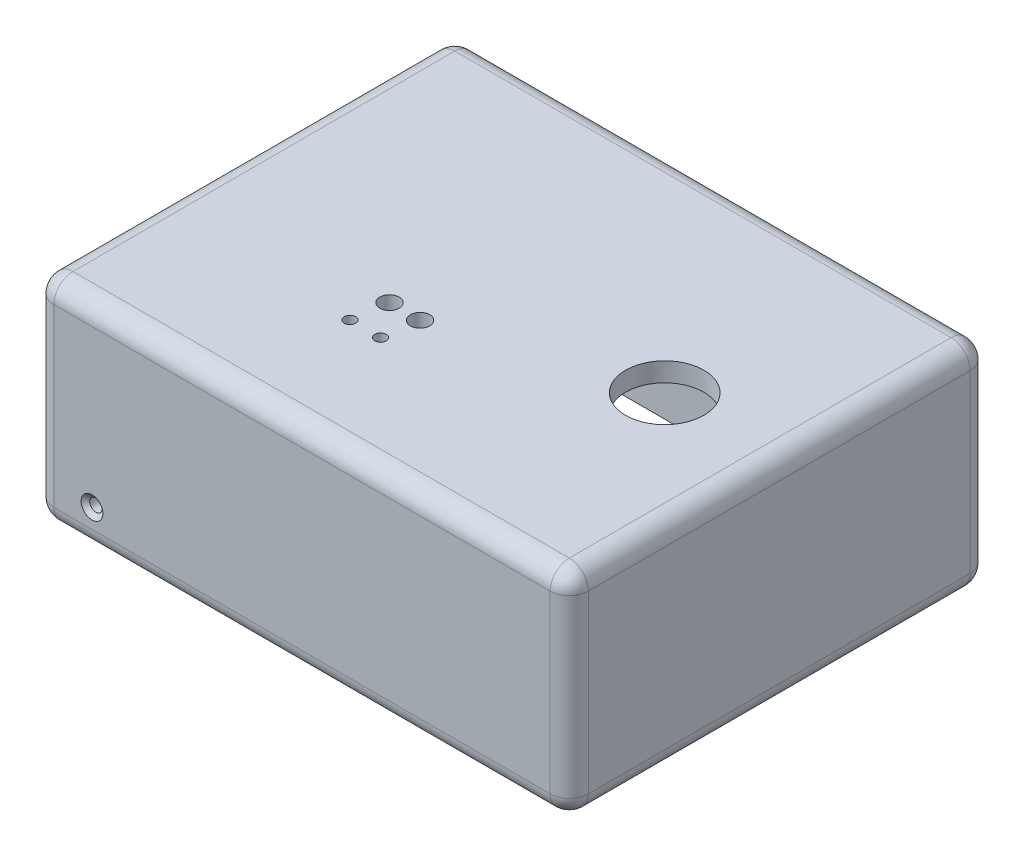
from build123d import *

# Parameters (mm, degrees)
SKETCH1_W                                         = 140
SKETCH1_H                                         = 110
BOSS_EXTRUDE1_DEPTH                               = 56
SKETCH2_W                                         = 130
SKETCH2_H                                         = 100
CUT_EXTRUDE1_DEPTH                                = 51
FILLET1_R                                         = 5
FILLET2_R                                         = 5
FILLET3_R                                         = 5
FILLET4_R                                         = 5
FILLET6_R                                         = 5
SKETCH3_R                                         = 2.54
CUT_EXTRUDE2_DEPTH                                = 5
SKETCH4_R                                         = 10.25
CUT_EXTRUDE3_DEPTH                                = 5
SKETCH5_R                                         = 1.5
CUT_EXTRUDE4_DEPTH                                = 5
CSK_FOR_4_FLAT_HEAD_MACHINE_SCREW_100_D           = 3.2639
CSK_FOR_4_FLAT_HEAD_MACHINE_SCREW_100_DEPTH       = 10
CSK_FOR_4_FLAT_HEAD_MACHINE_SCREW_100_CSINK_D     = 5.715
CSK_FOR_4_FLAT_HEAD_MACHINE_SCREW_100_CSINK_ANGLE = 100
CSK_FOR_4_FLAT_HEAD_MACHINE_SCREW_100_TIP         = 0.980574487
CSK_FOR_4_FLAT_HEAD_MACHINE_SCREW_2_D             = 3.2639
CSK_FOR_4_FLAT_HEAD_MACHINE_SCREW_2_DEPTH         = 10
CSK_FOR_4_FLAT_HEAD_MACHINE_SCREW_2_CSINK_D       = 5.715
CSK_FOR_4_FLAT_HEAD_MACHINE_SCREW_2_CSINK_ANGLE   = 100
CSK_FOR_4_FLAT_HEAD_MACHINE_SCREW_2_TIP           = 0.980574487


# Some blends are built 0.0001 mm under size
with BuildPart() as part:
    # Sketch1 → Boss-Extrude1 (new body)
    with BuildSketch(Plane(origin=(0, 0, 0), x_dir=(1, 0, 0), z_dir=(0, 1, 0))):
        Rectangle(SKETCH1_W, SKETCH1_H)
    extrude(amount=BOSS_EXTRUDE1_DEPTH)

    # Sketch2 → Cut-Extrude1 (cut)
    with BuildSketch(Plane.XZ):
        Rectangle(SKETCH2_W, SKETCH2_H)
    extrude(amount=-CUT_EXTRUDE1_DEPTH, mode=Mode.SUBTRACT)

    # Fillet1
    fillet1_edges = [part.edges().sort_by_distance(p)[0] for p in [
        (-70, 56, 0),
        (0, 56, 55),
        (70, 56, 0),
        (0, 56, -55),
    ]]
    fillet(fillet1_edges, radius=FILLET1_R)

    # Fillet2
    # the kernel refuses this fillet: 5 mm, written as the material it takes off along each edge
    with BuildSketch(Plane(origin=(65, 51, 50), x_dir=(1, 0, 0), z_dir=(0, 0, 1))) as fillet2_piece_1_section:
        Polygon((0, 0), (FILLET2_R, 0), (FILLET2_R, FILLET2_R), (0, FILLET2_R), align=None)
    fillet2_piece_1 = extrude(amount=FILLET2_R, mode=Mode.PRIVATE)
    fillet2_piece_1 = fillet2_piece_1 - Plane(origin=(65, 51, 50), x_dir=(-0.7071067811865475, -0.7071067811865475, 0), z_dir=(0, 0, 1)) * Sphere(FILLET2_R, mode=Mode.PRIVATE)
    add(fillet2_piece_1, mode=Mode.SUBTRACT)
    with BuildSketch(Plane(origin=(-65, 51, 50), x_dir=(-1, 0, 0), z_dir=(0, 0, 1))) as fillet2_piece_2_section:
        Polygon((0, 0), (FILLET2_R, 0), (FILLET2_R, -FILLET2_R), (0, -FILLET2_R), align=None)
    fillet2_piece_2 = extrude(amount=FILLET2_R, mode=Mode.PRIVATE)
    fillet2_piece_2 = fillet2_piece_2 - Plane(origin=(-65, 51, 50), x_dir=(0.7071067811865475, -0.7071067811865475, 0), z_dir=(0, 0, 1)) * Sphere(FILLET2_R, mode=Mode.PRIVATE)
    add(fillet2_piece_2, mode=Mode.SUBTRACT)
    with BuildSketch(Plane(origin=(65, 51, -50), x_dir=(0, 0, -1), z_dir=(1, 0, 0))) as fillet2_piece_3_section:
        Polygon((0, 0), (FILLET2_R, 0), (FILLET2_R, FILLET2_R), (0, FILLET2_R), align=None)
    fillet2_piece_3 = extrude(amount=FILLET2_R, mode=Mode.PRIVATE)
    fillet2_piece_3 = fillet2_piece_3 - Plane(origin=(65, 51, -50), x_dir=(0, -0.7071067811865475, 0.7071067811865475), z_dir=(1, 0, 0)) * Sphere(FILLET2_R, mode=Mode.PRIVATE)
    add(fillet2_piece_3, mode=Mode.SUBTRACT)
    with BuildSketch(Plane(origin=(-65, 51, -50), x_dir=(0, 0, -1), z_dir=(-1, 0, 0))) as fillet2_piece_4_section:
        Polygon((0, 0), (FILLET2_R, 0), (FILLET2_R, -FILLET2_R), (0, -FILLET2_R), align=None)
    fillet2_piece_4 = extrude(amount=FILLET2_R, mode=Mode.PRIVATE)
    fillet2_piece_4 = fillet2_piece_4 - Plane(origin=(-65, 51, -50), x_dir=(0, -0.7071067811865475, 0.7071067811865475), z_dir=(-1, 0, 0)) * Sphere(FILLET2_R, mode=Mode.PRIVATE)
    add(fillet2_piece_4, mode=Mode.SUBTRACT)
    with BuildSketch(Plane(origin=(-70, -12.5, -55), x_dir=(0, 0, 1), z_dir=(0, 1, 0)), Plane(origin=(-70, -12.5, 55), x_dir=(1, 0, 0), z_dir=(0, 1, 0))) as fillet2_piece_5:
        with BuildLine():
            CenterArc((FILLET2_R, FILLET2_R), FILLET2_R, 180, 90)
            Line((0, FILLET2_R), (0, 0))
            Line((0, 0), (FILLET2_R, 0))
        make_face()
    extrude(amount=63.5, mode=Mode.SUBTRACT)
    with BuildSketch(Plane(origin=(70, -12.5, -55), x_dir=(0, 0, 1), z_dir=(0, 1, 0)), Plane(origin=(70, -12.5, 55), x_dir=(-1, 0, 0), z_dir=(0, 1, 0))) as fillet2_piece_6:
        with BuildLine():
            CenterArc((FILLET2_R, -FILLET2_R), FILLET2_R, 90, 90)
            Line((0, -FILLET2_R), (0, 0))
            Line((0, 0), (FILLET2_R, 0))
        make_face()
    extrude(amount=63.5, mode=Mode.SUBTRACT)

    # Fillet3
    fillet3_edges = [part.edges().sort_by_distance(p)[0] for p in [
        (65, 51, 0),
        (0, 51, -50),
        (-65, 51, 0),
        (0, 51, 50),
    ]]
    fillet(fillet3_edges, radius=FILLET3_R)

    # Fillet4
    # the kernel refuses this fillet: 5 mm, written as the material it adds along each edge
    with BuildSketch(Plane(origin=(-60, 46, -45), x_dir=(0, 0, -1), z_dir=(-1, 0, 0))) as fillet4_piece_1_section:
        Polygon((0, 0), (FILLET4_R, 0), (FILLET4_R, -FILLET4_R), (0, -FILLET4_R), align=None)
    fillet4_piece_1 = extrude(amount=FILLET4_R, mode=Mode.PRIVATE)
    fillet4_piece_1 = fillet4_piece_1 - Plane(origin=(-60, 46, -45), x_dir=(0, -0.7071067811865475, 0.7071067811865475), z_dir=(-1, 0, 0)) * Sphere(FILLET4_R, mode=Mode.PRIVATE)
    add(fillet4_piece_1)
    with BuildSketch(Plane(origin=(-60, 46, 45), x_dir=(0, 0, 1), z_dir=(-1, 0, 0))) as fillet4_piece_2_section:
        Polygon((0, 0), (FILLET4_R, 0), (FILLET4_R, FILLET4_R), (0, FILLET4_R), align=None)
    fillet4_piece_2 = extrude(amount=FILLET4_R, mode=Mode.PRIVATE)
    fillet4_piece_2 = fillet4_piece_2 - Plane(origin=(-60, 46, 45), x_dir=(0, -0.7071067811865475, -0.7071067811865475), z_dir=(-1, 0, 0)) * Sphere(FILLET4_R, mode=Mode.PRIVATE)
    add(fillet4_piece_2)
    with BuildSketch(Plane(origin=(60, 46, -45), x_dir=(1, 0, 0), z_dir=(0, 0, -1))) as fillet4_piece_3_section:
        Polygon((0, 0), (FILLET4_R, 0), (FILLET4_R, -FILLET4_R), (0, -FILLET4_R), align=None)
    fillet4_piece_3 = extrude(amount=FILLET4_R, mode=Mode.PRIVATE)
    fillet4_piece_3 = fillet4_piece_3 - Plane(origin=(60, 46, -45), x_dir=(-0.7071067811865475, -0.7071067811865475, 0), z_dir=(0, 0, -1)) * Sphere(FILLET4_R, mode=Mode.PRIVATE)
    add(fillet4_piece_3)
    with BuildSketch(Plane(origin=(60, 46, 45), x_dir=(1, 0, 0), z_dir=(0, 0, 1))) as fillet4_piece_4_section:
        Polygon((0, 0), (FILLET4_R, 0), (FILLET4_R, FILLET4_R), (0, FILLET4_R), align=None)
    fillet4_piece_4 = extrude(amount=FILLET4_R, mode=Mode.PRIVATE)
    fillet4_piece_4 = fillet4_piece_4 - Plane(origin=(60, 46, 45), x_dir=(-0.7071067811865475, -0.7071067811865475, 0), z_dir=(0, 0, 1)) * Sphere(FILLET4_R, mode=Mode.PRIVATE)
    add(fillet4_piece_4)
    with BuildSketch(Plane(origin=(65, 0, 50), x_dir=(-1, 0, 0), z_dir=(0, 1, 0)), Plane(origin=(-65, 0, 50), x_dir=(0, 0, -1), z_dir=(0, 1, 0))) as fillet4_piece_5:
        with BuildLine():
            CenterArc((FILLET4_R, -FILLET4_R), FILLET4_R, 90, 90)
            Line((0, -FILLET4_R), (0, 0))
            Line((0, 0), (FILLET4_R, 0))
        make_face()
    extrude(amount=46)
    with BuildSketch(Plane(origin=(65, 0, -50), x_dir=(-1, 0, 0), z_dir=(0, 1, 0)), Plane(origin=(-65, 0, -50), x_dir=(0, 0, 1), z_dir=(0, 1, 0))) as fillet4_piece_6:
        with BuildLine():
            CenterArc((FILLET4_R, FILLET4_R), FILLET4_R, 180, 90)
            Line((0, FILLET4_R), (0, 0))
            Line((0, 0), (FILLET4_R, 0))
        make_face()
    extrude(amount=46)

    # Fillet6
    fillet6_edges = [part.edges().sort_by_distance(p)[0] for p in [
        (-70, 0, 0),
        (70, 0, 0),
        (0, 0, 55),
        (0, 0, -55),
        (-68.535533906, 0, 53.535533906),
        (68.535533906, 0, 53.535533906),
        (68.535533906, 0, -53.535533906),
        (-68.535533906, 0, -53.535533906),
    ]]
    fillet(fillet6_edges, radius=FILLET6_R - 0.0001)  # a hair under: the kernel refuses the full size

    # Sketch3 → Cut-Extrude2 (cut)
    with BuildSketch(Plane(origin=(0, 56, 0), x_dir=(1, 0, 0), z_dir=(0, 1, 0))):
        with Locations(Location((-16.48, -15.61, 0), (0, 0, 270))):
            Circle(SKETCH3_R)
        with Locations(Location((-8.48, -15.61, 0), (0, 0, 270))):
            Circle(SKETCH3_R)
    extrude(amount=-CUT_EXTRUDE2_DEPTH, mode=Mode.SUBTRACT)

    # Sketch4 → Cut-Extrude3 (cut)
    with BuildSketch(Plane(origin=(0, 56, 0), x_dir=(1, 0, 0), z_dir=(0, 1, 0))):
        with Locations(Location((40, 0, 0), (0, 0, 270))):
            Circle(SKETCH4_R)
    extrude(amount=-CUT_EXTRUDE3_DEPTH, mode=Mode.SUBTRACT)

    # Sketch5 → Cut-Extrude4 (cut)
    with BuildSketch(Plane(origin=(0, 56, 0), x_dir=(1, 0, 0), z_dir=(0, 1, 0))):
        with Locations(Location((-17.725, -24.71, 0), (0, 0, 270))):
            Circle(SKETCH5_R)
        with Locations(Location((-9.725, -24.71, 0), (0, 0, 270))):
            Circle(SKETCH5_R)
    extrude(amount=-CUT_EXTRUDE4_DEPTH, mode=Mode.SUBTRACT)

    # CSK for _4 Flat Head Machine Screw _100
    with Locations(Plane(origin=(58.965440854, 7.381222334, 55), x_dir=(1, 0, 0), z_dir=(0, 0, 1))):
        with Locations((-113.965440854, 2.618777666)):
            CounterSinkHole(CSK_FOR_4_FLAT_HEAD_MACHINE_SCREW_100_D / 2, CSK_FOR_4_FLAT_HEAD_MACHINE_SCREW_100_CSINK_D / 2, depth=CSK_FOR_4_FLAT_HEAD_MACHINE_SCREW_100_DEPTH, counter_sink_angle=CSK_FOR_4_FLAT_HEAD_MACHINE_SCREW_100_CSINK_ANGLE)
            with Locations((0, 0, -(CSK_FOR_4_FLAT_HEAD_MACHINE_SCREW_100_DEPTH + CSK_FOR_4_FLAT_HEAD_MACHINE_SCREW_100_TIP / 2))):  # 118° drill point
                Cone(0, CSK_FOR_4_FLAT_HEAD_MACHINE_SCREW_100_D / 2, CSK_FOR_4_FLAT_HEAD_MACHINE_SCREW_100_TIP, mode=Mode.SUBTRACT)

    # CSK for _4 Flat Head Machine Screw _ 2
    with Locations(Plane(origin=(58.965440854, 7.381222334, -55), x_dir=(-1, 0, 0), z_dir=(0, 0, -1))):
        with Locations((3.965440854, 2.618777666)):
            CounterSinkHole(CSK_FOR_4_FLAT_HEAD_MACHINE_SCREW_2_D / 2, CSK_FOR_4_FLAT_HEAD_MACHINE_SCREW_2_CSINK_D / 2, depth=CSK_FOR_4_FLAT_HEAD_MACHINE_SCREW_2_DEPTH, counter_sink_angle=CSK_FOR_4_FLAT_HEAD_MACHINE_SCREW_2_CSINK_ANGLE)
            with Locations((0, 0, -(CSK_FOR_4_FLAT_HEAD_MACHINE_SCREW_2_DEPTH + CSK_FOR_4_FLAT_HEAD_MACHINE_SCREW_2_TIP / 2))):  # 118° drill point
                Cone(0, CSK_FOR_4_FLAT_HEAD_MACHINE_SCREW_2_D / 2, CSK_FOR_4_FLAT_HEAD_MACHINE_SCREW_2_TIP, mode=Mode.SUBTRACT)


solid = part.part
